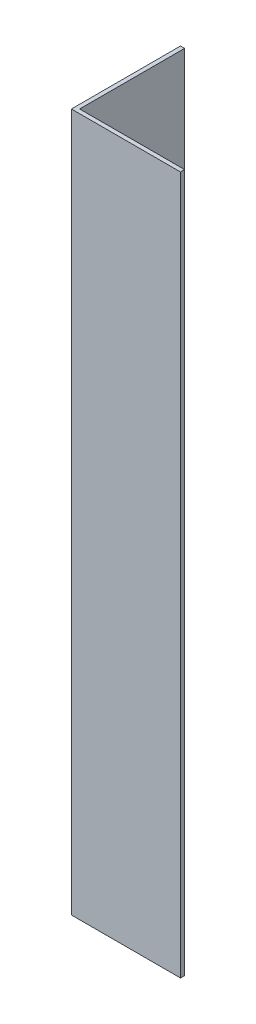
from build123d import *

# Parameters (mm, degrees)
EXTRUDE_1_DEPTH = 128


with BuildPart() as part:
    # Эскиз1 → Бобышка-Вытянуть1 (new body)
    with BuildSketch(Plane(origin=(0, 0, 0), x_dir=(1, 0, 0), z_dir=(0, 1, 0))):
        Polygon((0, 0), (0, 20), (0.75, 20), (0.75, 0.75), (20, 0.75), (20, 0), align=None)
    extrude(amount=EXTRUDE_1_DEPTH)


solid = part.part
